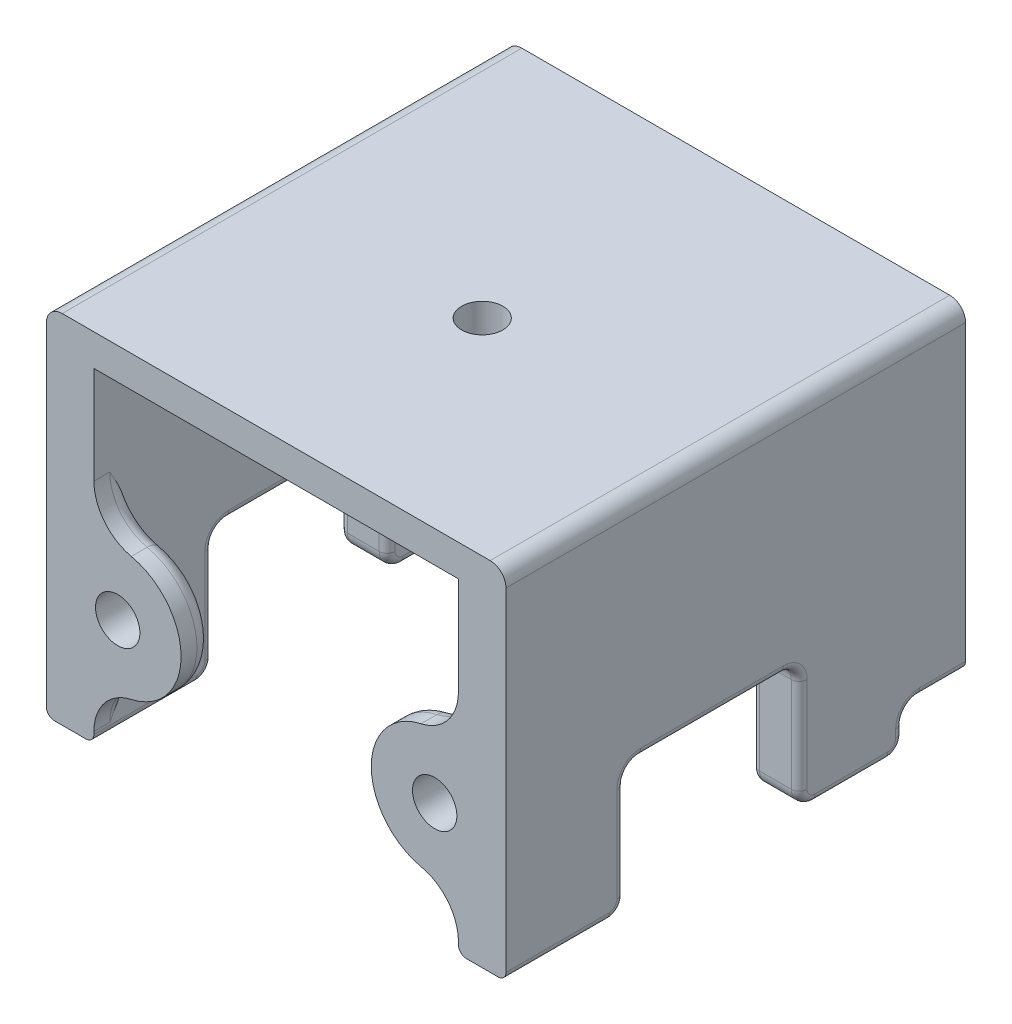
from build123d import *
from OCP.BRepFilletAPI import BRepFilletAPI_MakeChamfer

# Parameters (mm, degrees)
SKIZZE1_W                            = 58
SKIZZE1_H                            = 40
SKIZZE1_R                            = 2.4
SKIZZE1_R_2                          = 1.6
AUFSATZ_LINEAR_AUSTRAGEN1_DEPTH      = 8
AUFSATZ_LINEAR_AUSTRAGEN2_DEPTH      = 50
SCHNITT_LINEAR_AUSTRAGEN6_DEPTH      = 10
SCHNITT_LINEAR_AUSTRAGEN6_DEPTH_BACK = 4
SKIZZE10_R                           = 8
AUFSATZ_LINEAR_AUSTRAGEN3_DEPTH      = 4
SKIZZE13_W                           = 6
SKIZZE13_H                           = 50.174433159
AUFSATZ_LINEAR_AUSTRAGEN4_DEPTH      = 5
VERRUNDUNG1_R                        = 6
VERRUNDUNG3_R                        = 2
SKIZZE11_R                           = 2.8
SCHNITT_LINEAR_AUSTRAGEN7_DEPTH      = 4
SKIZZE7_R                            = 2
SCHNITT_LINEAR_AUSTRAGEN2_DEPTH      = 14
VERRUNDUNG4_R                        = 2
SKIZZE12_W                           = 58
SKIZZE12_H                           = 22
SCHNITT_LINEAR_AUSTRAGEN8_DEPTH      = 16
VERRUNDUNG5_R                        = 2
FASE4_SIZE                           = 4.5
FASE4_SIZE2                          = 1.205771366
LINEARES_MUSTER1_COUNT               = 2
LINEARES_MUSTER1_PITCH               = 52
VERRUNDUNG6_R                        = 1
SKIZZE16_R                           = 16
AUFSATZ_LINEAR_AUSTRAGEN7_DEPTH      = 20
FASE8_SIZE                           = 12
FASE8_SIZE2                          = 6.92820323
SKITZE_AXIS_R                        = 2.6
SCHNITT_LINEAR_AUSTRAGEN10_DEPTH     = 20


# Read off the part's stored shape, not the designer's step: Aufsatz-Linear austragen2
with BuildPart() as part:
    # Skizze1 → Aufsatz-Linear austragen1 (new body)
    with BuildSketch(Plane.XY):
        with Locations((0, -20)):
            Rectangle(SKIZZE1_W, SKIZZE1_H)
        with Locations((-20, -10)):
            Circle(SKIZZE1_R, mode=Mode.SUBTRACT)
        with Locations((0, -10)):
            Circle(SKIZZE1_R, mode=Mode.SUBTRACT)
        with Locations((20, -10)):
            Circle(SKIZZE1_R, mode=Mode.SUBTRACT)
        with Locations((0, -30)):
            Circle(SKIZZE1_R, mode=Mode.SUBTRACT)
        with Locations((20, -30)):
            Circle(SKIZZE1_R, mode=Mode.SUBTRACT)
        with Locations((-20, -30)):
            Circle(SKIZZE1_R, mode=Mode.SUBTRACT)
        with Locations((-10, -20)):
            Circle(SKIZZE1_R_2, mode=Mode.SUBTRACT)
        with Locations((10, -20)):
            Circle(SKIZZE1_R_2, mode=Mode.SUBTRACT)
    extrude(amount=AUFSATZ_LINEAR_AUSTRAGEN1_DEPTH)

    # Aufsatz-Linear austragen2 outline → Aufsatz-Linear austragen2 (add)
    with BuildSketch(Plane.XY.offset(8)):
        Polygon((23, -40), (29, -40), (29, 0), (-29, 0), (-29, -40), (-23, -40), (-23, -4), (23, -4), align=None)
    extrude(amount=AUFSATZ_LINEAR_AUSTRAGEN2_DEPTH)

    # Skizze9 → Schnitt-Linear austragen6 (cut, two sides: drawn at the far end of the back side and taken through both)
    with BuildSketch(Plane.XY.offset(8).offset(-SCHNITT_LINEAR_AUSTRAGEN6_DEPTH_BACK)):
        Polygon((3.5, -7.979274058), (0, -5.958548116), (-3.5, -7.979274058), (-3.5, -12.020725942), (0, -14.041451884), (3.5, -12.020725942), align=None)
        Polygon((-16.5, -7.979274058), (-20, -5.958548116), (-23.5, -7.979274058), (-23.5, -12.020725942), (-20, -14.041451884), (-16.5, -12.020725942), align=None)
        Polygon((23.5, -7.979274058), (20, -5.958548116), (16.5, -7.979274058), (16.5, -12.020725942), (20, -14.041451884), (23.5, -12.020725942), align=None)
        Polygon((3.5, -27.979274058), (0, -25.958548116), (-3.5, -27.979274058), (-3.5, -32.020725942), (0, -34.041451884), (3.5, -32.020725942), align=None)
        Polygon((23.5, -27.979274058), (20, -25.958548116), (16.5, -27.979274058), (16.5, -32.020725942), (20, -34.041451884), (23.5, -32.020725942), align=None)
        Polygon((-16.5, -27.979274058), (-20, -25.958548116), (-23.5, -27.979274058), (-23.5, -32.020725942), (-20, -34.041451884), (-16.5, -32.020725942), align=None)
    extrude(amount=SCHNITT_LINEAR_AUSTRAGEN6_DEPTH + SCHNITT_LINEAR_AUSTRAGEN6_DEPTH_BACK, mode=Mode.SUBTRACT)

    # Skizze10 → Aufsatz-Linear austragen3 (add)
    with BuildSketch(Plane.XY.offset(58)):
        with Locations((20, -30)):
            Circle(SKIZZE10_R)
        with Locations((-20, -30)):
            Circle(SKIZZE10_R)
    extrude(amount=-AUFSATZ_LINEAR_AUSTRAGEN3_DEPTH)

    # Skizze13 → Aufsatz-Linear austragen4 (add)
    with BuildSketch(Plane.XZ.offset(40)):
        with Locations((-26, 32.912783421)):
            Rectangle(SKIZZE13_W, SKIZZE13_H)
        with Locations((26, 32.912783421)):
            Rectangle(SKIZZE13_W, SKIZZE13_H)
    extrude(amount=AUFSATZ_LINEAR_AUSTRAGEN4_DEPTH)

    # Verrundung1
    verrundung1_edges = [part.edges().sort_by_distance(p)[0] for p in [
        (23, -37.416198487, 56),
        (23, -22.583801513, 56),
        (-23, -37.416198487, 56),
        (-23, -22.583801513, 56),
    ]]
    fillet(verrundung1_edges, radius=VERRUNDUNG1_R)

    # Verrundung3
    # the kernel refuses this fillet: 2 mm, written as the material it takes off along each edge
    with BuildSketch(Plane(origin=(-20, -30, 54), x_dir=(0.21428571428571433, -0.9767710236555245, 0), z_dir=(-0.9767710236555245, -0.21428571428571433, 0))) as verrundung3_piece_1:
        with BuildLine():
            CenterArc((8 - VERRUNDUNG3_R, VERRUNDUNG3_R), VERRUNDUNG3_R, 270, 90)
            Line((8 - VERRUNDUNG3_R, 0), (8, 0))
            Line((8, 0), (8, VERRUNDUNG3_R))
        make_face()
    revolve(axis=Axis((-20, -30, 54), (0, 0, 1)), revolution_arc=155.252749768, mode=Mode.SUBTRACT)
    with BuildSketch(Plane(origin=(20, -30, 54), x_dir=(-0.21428571428571433, 0.9767710236555245, 0), z_dir=(0.9767710236555245, 0.21428571428571433, 0))) as verrundung3_piece_2:
        with BuildLine():
            CenterArc((8 - VERRUNDUNG3_R, VERRUNDUNG3_R), VERRUNDUNG3_R, 270, 90)
            Line((8 - VERRUNDUNG3_R, 0), (8, 0))
            Line((8, 0), (8, VERRUNDUNG3_R))
        make_face()
    revolve(axis=Axis((20, -30, 54), (0, 0, 1)), revolution_arc=155.252749768, mode=Mode.SUBTRACT)
    with BuildSketch(Plane(origin=(-17, -16.325205669, 54), x_dir=(-0.6722279054593165, 0.7403442733767718, 0), z_dir=(0.7403442733767718, 0.6722279054593165, 0))) as verrundung3_piece_3_section:
        with BuildLine():
            CenterArc((6 + VERRUNDUNG3_R, VERRUNDUNG3_R), VERRUNDUNG3_R, 180, 90)
            Line((6 + VERRUNDUNG3_R, 0), (6, 0))
            Line((6, 0), (6, VERRUNDUNG3_R))
        make_face()
    verrundung3_piece_3 = revolve(axis=Axis((-17, -16.325205669, 54), (0, 0, 1)), revolution_arc=125.387125524, mode=Mode.PRIVATE)
    verrundung3_piece_3 = split(verrundung3_piece_3, bisect_by=Plane(origin=(-23, -20.355034942, 54.516064296), z_dir=(1, 0, 0)), keep=Keep.TOP, mode=Mode.PRIVATE)
    add(verrundung3_piece_3, mode=Mode.SUBTRACT)
    with BuildSketch(Plane(origin=(-17, -43.674794331, 54), x_dir=(-0.6722279054593165, -0.7403442733767718, 0), z_dir=(0.7403442733767718, -0.6722279054593165, 0))) as verrundung3_piece_4_section:
        with BuildLine():
            CenterArc((6 + VERRUNDUNG3_R, -VERRUNDUNG3_R), VERRUNDUNG3_R, 90, 90)
            Line((6, -VERRUNDUNG3_R), (6, 0))
            Line((6, 0), (6 + VERRUNDUNG3_R, 0))
        make_face()
    verrundung3_piece_4 = revolve(axis=Axis((-17, -43.674794331, 54), (0, 0, -1)), revolution_arc=125.387125524, mode=Mode.PRIVATE)
    verrundung3_piece_4 = split(verrundung3_piece_4, bisect_by=Plane(origin=(-23, -39.644965239, 54.51606418), z_dir=(1, 0, 0)), keep=Keep.TOP, mode=Mode.PRIVATE)
    add(verrundung3_piece_4, mode=Mode.SUBTRACT)
    with BuildSketch(Plane(origin=(17, -43.674794331, 54), x_dir=(0.6722279054593165, -0.7403442733767718, 0), z_dir=(-0.7403442733767718, -0.6722279054593165, 0))) as verrundung3_piece_5_section:
        with BuildLine():
            CenterArc((6 + VERRUNDUNG3_R, VERRUNDUNG3_R), VERRUNDUNG3_R, 180, 90)
            Line((6 + VERRUNDUNG3_R, 0), (6, 0))
            Line((6, 0), (6, VERRUNDUNG3_R))
        make_face()
    verrundung3_piece_5 = revolve(axis=Axis((17, -43.674794331, 54), (0, 0, 1)), revolution_arc=125.387125524, mode=Mode.PRIVATE)
    verrundung3_piece_5 = split(verrundung3_piece_5, bisect_by=Plane(origin=(23, -39.644963205, 54.516060737), z_dir=(-1, 0, 0)), keep=Keep.TOP, mode=Mode.PRIVATE)
    add(verrundung3_piece_5, mode=Mode.SUBTRACT)
    with BuildSketch(Plane(origin=(17, -16.325205669, 54), x_dir=(0.672227905459316, 0.7403442733767723, 0), z_dir=(-0.7403442733767723, 0.672227905459316, 0))) as verrundung3_piece_6_section:
        with BuildLine():
            CenterArc((6 + VERRUNDUNG3_R, -VERRUNDUNG3_R), VERRUNDUNG3_R, 90, 90)
            Line((6, -VERRUNDUNG3_R), (6, 0))
            Line((6, 0), (6 + VERRUNDUNG3_R, 0))
        make_face()
    verrundung3_piece_6 = revolve(axis=Axis((17, -16.325205669, 54), (0, 0, -1)), revolution_arc=125.387125524, mode=Mode.PRIVATE)
    verrundung3_piece_6 = split(verrundung3_piece_6, bisect_by=Plane(origin=(23, -20.355037546, 54.516064213), z_dir=(-1, 0, 0)), keep=Keep.TOP, mode=Mode.PRIVATE)
    add(verrundung3_piece_6, mode=Mode.SUBTRACT)

    # Skizze11 → Schnitt-Linear austragen7 (cut)
    with BuildSketch(Plane.XY.offset(58)):
        with Locations((20, -30)):
            Circle(SKIZZE11_R)
        with Locations((-20, -30)):
            Circle(SKIZZE11_R)
    extrude(amount=-SCHNITT_LINEAR_AUSTRAGEN7_DEPTH, mode=Mode.SUBTRACT)

    # Skizze7 → Schnitt-Linear austragen2 (cut)
    with BuildSketch(Plane.XZ.offset(45)):
        with Locations(Location((26, 15.300827002, 0), (0, 0, 270))):
            Circle(SKIZZE7_R)
        with Locations(Location((26, 50.800827002, 0), (0, 0, 270))):
            Circle(SKIZZE7_R)
    schnitt_linear_austragen2 = extrude(amount=-SCHNITT_LINEAR_AUSTRAGEN2_DEPTH, mode=Mode.SUBTRACT)

    # Verrundung4
    verrundung4_edges = [part.edges().sort_by_distance(p)[0] for p in [
        (-29, 0, 29),
        (29, 0, 29),
    ]]
    fillet(verrundung4_edges, radius=VERRUNDUNG4_R)

    # Skizze12 → Schnitt-Linear austragen8 (cut)
    with BuildSketch(Plane.XZ.offset(45)):
        with Locations((0, 32)):
            Rectangle(SKIZZE12_W, SKIZZE12_H)
    extrude(amount=-SCHNITT_LINEAR_AUSTRAGEN8_DEPTH, mode=Mode.SUBTRACT)

    # Verrundung5
    verrundung5_edges = [part.edges().sort_by_distance(p)[0] for p in [
        (-26, -40, 7.825566841),
        (-26, -45, 7.825566841),
        (26, -40, 7.825566841),
        (26, -45, 7.825566841),
        (26, -45, 21),
        (-26, -45, 21),
        (-26, -45, 43),
        (-26, -29, 43),
        (-26, -29, 21),
        (26, -29, 43),
        (26, -29, 21),
        (26, -45, 43),
    ]]
    fillet(verrundung5_edges, radius=VERRUNDUNG5_R)

    # Fase4: one chamfer whose edges measure the first distance from different faces: ONE call of the kernel's chamfer builder (chamfer() names one face for all edges)
    fase4_edges_1 = [part.edges().sort_by_distance(p)[0] for p in [
        (-11.6, -20, 0),
    ]]
    fase4_side_1 = [part.faces().sort_by_distance(p)[0] for p in [
        (-11.6, -20, 4),
    ]]
    fase4_edges_2 = [part.edges().sort_by_distance(p)[0] for p in [
        (8.4, -20, 0),
    ]]
    fase4_side_2 = [part.faces().sort_by_distance(p)[0] for p in [
        (8.4, -20, 4),
    ]]
    fase4 = BRepFilletAPI_MakeChamfer(part.part.solid().wrapped)
    for e in fase4_edges_1:
        fase4.Add(FASE4_SIZE, FASE4_SIZE2, e.wrapped, fase4_side_1[0].wrapped)  # the first distance lies on this face
    for e in fase4_edges_2:
        fase4.Add(FASE4_SIZE, FASE4_SIZE2, e.wrapped, fase4_side_2[0].wrapped)  # the first distance lies on this face
    add(Compound.cast(fase4.Shape()), mode=Mode.REPLACE)

    # Lineares Muster1: Schnitt-Linear austragen2 ×2
    with Locations(*[(-i * LINEARES_MUSTER1_PITCH, 0, 0) for i in range(1, LINEARES_MUSTER1_COUNT)]):
        add(schnitt_linear_austragen2, mode=Mode.SUBTRACT)

    # Verrundung6
    # the kernel refuses this fillet: 1 mm, written as the material it takes off along each edge
    with BuildSketch(Plane(origin=(-23, -42, 5.825566841), x_dir=(0, 0.3148458040869784, -0.9491428341660828), z_dir=(0, -0.9491428341660828, -0.3148458040869784))) as verrundung6_piece_1_section:
        with BuildLine():
            CenterArc((2 + VERRUNDUNG6_R, -VERRUNDUNG6_R), VERRUNDUNG6_R, 90, 90)
            Line((2, -VERRUNDUNG6_R), (2, 0))
            Line((2, 0), (2 + VERRUNDUNG6_R, 0))
        make_face()
    verrundung6_piece_1 = revolve(axis=Axis((-23, -42, 5.825566841), (1, 0, 0)), revolution_arc=161.648494619, mode=Mode.PRIVATE)
    verrundung6_piece_1 = split(verrundung6_piece_1, bisect_by=Plane(origin=(-23.272151062, -40, 7.287763131), z_dir=(0, -1, 0)), keep=Keep.TOP, mode=Mode.PRIVATE)
    add(verrundung6_piece_1, mode=Mode.SUBTRACT)
    with BuildSketch(Plane(origin=(-23, -42, 5.825566841), x_dir=(0, 0.3148458040869784, -0.9491428341660828), z_dir=(0, -0.9491428341660828, -0.3148458040869784))) as verrundung6_piece_2_section:
        with BuildLine():
            CenterArc((2 + VERRUNDUNG6_R, -VERRUNDUNG6_R), VERRUNDUNG6_R, 90, 90)
            Line((2, -VERRUNDUNG6_R), (2, 0))
            Line((2, 0), (2 + VERRUNDUNG6_R, 0))
        make_face()
    verrundung6_piece_2 = revolve(axis=Axis((-23, -42, 5.825566841), (1, 0, 0)), revolution_arc=161.648494619, mode=Mode.PRIVATE)
    verrundung6_piece_2 = split(verrundung6_piece_2, bisect_by=Plane(origin=(-23.00020869, -39.986552232, 8), z_dir=(0, 0, 1)), keep=Keep.TOP, mode=Mode.PRIVATE)
    add(verrundung6_piece_2, mode=Mode.SUBTRACT)
    with BuildSketch(Plane(origin=(-23, -42, 7.825566841), x_dir=(0, 0, 1), z_dir=(0, -1, 0)), Plane(origin=(29, -42, 7.825566841), x_dir=(0, 0, 1), z_dir=(0, -1, 0))) as verrundung6_piece_3:
        with BuildLine():
            CenterArc((VERRUNDUNG6_R, VERRUNDUNG6_R), VERRUNDUNG6_R, 180, 90)
            Line((0, VERRUNDUNG6_R), (0, 0))
            Line((0, 0), (VERRUNDUNG6_R, 0))
        make_face()
    extrude(amount=1, mode=Mode.SUBTRACT)
    with BuildSketch(Plane(origin=(-23, -43, 9.825566841), x_dir=(0, -1, 0), z_dir=(0, 0, 1))) as verrundung6_piece_4:
        with BuildLine():
            CenterArc((2 - VERRUNDUNG6_R, -VERRUNDUNG6_R), VERRUNDUNG6_R, 0, 90)
            Line((2, -VERRUNDUNG6_R), (2, 0))
            Line((2, 0), (2 - VERRUNDUNG6_R, 0))
        make_face()
    revolve(axis=Axis((-23, -43, 9.825566841), (1, 0, 0)), revolution_arc=90, mode=Mode.SUBTRACT)
    with BuildSketch(Plane(origin=(-23, -45, 19), x_dir=(0, 1, 0), z_dir=(0, 0, -1)), Plane(origin=(-29, -45, 9.825566841), x_dir=(0, 1, 0), z_dir=(0, 0, 1)), Plane(origin=(23, -45, 9.825566841), x_dir=(0, 1, 0), z_dir=(0, 0, 1)), Plane(origin=(29, -45, 19), x_dir=(0, 1, 0), z_dir=(0, 0, -1))) as verrundung6_piece_5:
        with BuildLine():
            CenterArc((VERRUNDUNG6_R, -VERRUNDUNG6_R), VERRUNDUNG6_R, 90, 90)
            Line((0, -VERRUNDUNG6_R), (0, 0))
            Line((0, 0), (VERRUNDUNG6_R, 0))
        make_face()
    extrude(amount=9.174433159, mode=Mode.SUBTRACT)
    with BuildSketch(Plane(origin=(-23, -43, 19), x_dir=(0, 0, 1), z_dir=(0, 1, 0))) as verrundung6_piece_6:
        with BuildLine():
            CenterArc((2 - VERRUNDUNG6_R, -VERRUNDUNG6_R), VERRUNDUNG6_R, 0, 90)
            Line((2, -VERRUNDUNG6_R), (2, 0))
            Line((2, 0), (2 - VERRUNDUNG6_R, 0))
        make_face()
    revolve(axis=Axis((-23, -43, 19), (1, 0, 0)), revolution_arc=90, mode=Mode.SUBTRACT)
    with BuildSketch(Plane(origin=(-23, -43, 21), x_dir=(0, 0, -1), z_dir=(0, 1, 0)), Plane(origin=(-23, -31, 43), x_dir=(0, 0, 1), z_dir=(0, -1, 0)), Plane(origin=(-29, -43, 43), x_dir=(0, 0, 1), z_dir=(0, 1, 0)), Plane(origin=(23, -31, 21), x_dir=(0, 0, -1), z_dir=(0, -1, 0)), Plane(origin=(23, -43, 43), x_dir=(0, 0, 1), z_dir=(0, 1, 0)), Plane(origin=(29, -43, 21), x_dir=(0, 0, -1), z_dir=(0, 1, 0))) as verrundung6_piece_7:
        with BuildLine():
            CenterArc((VERRUNDUNG6_R, VERRUNDUNG6_R), VERRUNDUNG6_R, 180, 90)
            Line((0, VERRUNDUNG6_R), (0, 0))
            Line((0, 0), (VERRUNDUNG6_R, 0))
        make_face()
    extrude(amount=12, mode=Mode.SUBTRACT)
    with BuildSketch(Plane(origin=(-23, -31, 23), x_dir=(0, 1, 0), z_dir=(0, 0, 1))) as verrundung6_piece_8:
        with BuildLine():
            CenterArc((2 + VERRUNDUNG6_R, VERRUNDUNG6_R), VERRUNDUNG6_R, 180, 90)
            Line((2, VERRUNDUNG6_R), (2, 0))
            Line((2, 0), (2 + VERRUNDUNG6_R, 0))
        make_face()
    revolve(axis=Axis((-23, -31, 23), (-1, 0, 0)), revolution_arc=90, mode=Mode.SUBTRACT)
    with BuildSketch(Plane(origin=(-23, -29, 41), x_dir=(0, 1, 0), z_dir=(0, 0, -1)), Plane(origin=(-29, -29, 23), x_dir=(0, 1, 0), z_dir=(0, 0, 1)), Plane(origin=(23, -29, 23), x_dir=(0, 1, 0), z_dir=(0, 0, 1)), Plane(origin=(29, -29, 41), x_dir=(0, 1, 0), z_dir=(0, 0, -1))) as verrundung6_piece_9:
        with BuildLine():
            CenterArc((VERRUNDUNG6_R, -VERRUNDUNG6_R), VERRUNDUNG6_R, 90, 90)
            Line((0, -VERRUNDUNG6_R), (0, 0))
            Line((0, 0), (VERRUNDUNG6_R, 0))
        make_face()
    extrude(amount=18, mode=Mode.SUBTRACT)
    with BuildSketch(Plane(origin=(-23, -31, 41), x_dir=(0, 0, 1), z_dir=(0, -1, 0))) as verrundung6_piece_10:
        with BuildLine():
            CenterArc((2 + VERRUNDUNG6_R, VERRUNDUNG6_R), VERRUNDUNG6_R, 180, 90)
            Line((2, VERRUNDUNG6_R), (2, 0))
            Line((2, 0), (2 + VERRUNDUNG6_R, 0))
        make_face()
    revolve(axis=Axis((-23, -31, 41), (-1, 0, 0)), revolution_arc=90, mode=Mode.SUBTRACT)
    with BuildSketch(Plane(origin=(-23, -43, 45), x_dir=(0, -1, 0), z_dir=(0, 0, 1))) as verrundung6_piece_11:
        with BuildLine():
            CenterArc((2 - VERRUNDUNG6_R, -VERRUNDUNG6_R), VERRUNDUNG6_R, 0, 90)
            Line((2, -VERRUNDUNG6_R), (2, 0))
            Line((2, 0), (2 - VERRUNDUNG6_R, 0))
        make_face()
    revolve(axis=Axis((-23, -43, 45), (1, 0, 0)), revolution_arc=90, mode=Mode.SUBTRACT)
    with BuildSketch(Plane(origin=(-29, -40, -2.5), x_dir=(1, 0, 0), z_dir=(0, 0, 1)), Plane(origin=(29, -40, 5.825566841), x_dir=(-1, 0, 0), z_dir=(0, 0, -1))) as verrundung6_piece_12:
        with BuildLine():
            CenterArc((VERRUNDUNG6_R, VERRUNDUNG6_R), VERRUNDUNG6_R, 180, 90)
            Line((0, VERRUNDUNG6_R), (0, 0))
            Line((0, 0), (VERRUNDUNG6_R, 0))
        make_face()
    extrude(amount=8.325566841, mode=Mode.SUBTRACT)
    with BuildSketch(Plane(origin=(-29, -42, 5.825566841), x_dir=(0, 1, 0), z_dir=(0, 0, -1))) as verrundung6_piece_13:
        with BuildLine():
            CenterArc((2 + VERRUNDUNG6_R, VERRUNDUNG6_R), VERRUNDUNG6_R, 180, 90)
            Line((2, VERRUNDUNG6_R), (2, 0))
            Line((2, 0), (2 + VERRUNDUNG6_R, 0))
        make_face()
    revolve(axis=Axis((-29, -42, 5.825566841), (1, 0, 0)), revolution_arc=90, mode=Mode.SUBTRACT)
    with BuildSketch(Plane(origin=(-29, -42, 7.825566841), x_dir=(0, 0, 1), z_dir=(0, -1, 0)), Plane(origin=(23, -42, 7.825566841), x_dir=(0, 0, 1), z_dir=(0, -1, 0))) as verrundung6_piece_14:
        with BuildLine():
            CenterArc((VERRUNDUNG6_R, -VERRUNDUNG6_R), VERRUNDUNG6_R, 90, 90)
            Line((0, -VERRUNDUNG6_R), (0, 0))
            Line((0, 0), (VERRUNDUNG6_R, 0))
        make_face()
    extrude(amount=1, mode=Mode.SUBTRACT)
    with BuildSketch(Plane(origin=(-29, -43, 9.825566841), x_dir=(0, -1, 0), z_dir=(0, 0, 1))) as verrundung6_piece_15:
        with BuildLine():
            CenterArc((2 - VERRUNDUNG6_R, VERRUNDUNG6_R), VERRUNDUNG6_R, 270, 90)
            Line((2, VERRUNDUNG6_R), (2, 0))
            Line((2, 0), (2 - VERRUNDUNG6_R, 0))
        make_face()
    revolve(axis=Axis((-29, -43, 9.825566841), (1, 0, 0)), revolution_arc=90, mode=Mode.SUBTRACT)
    with BuildSketch(Plane(origin=(-29, -43, 19), x_dir=(0, 0, 1), z_dir=(0, 1, 0))) as verrundung6_piece_16:
        with BuildLine():
            CenterArc((2 - VERRUNDUNG6_R, VERRUNDUNG6_R), VERRUNDUNG6_R, 270, 90)
            Line((2, VERRUNDUNG6_R), (2, 0))
            Line((2, 0), (2 - VERRUNDUNG6_R, 0))
        make_face()
    revolve(axis=Axis((-29, -43, 19), (1, 0, 0)), revolution_arc=90, mode=Mode.SUBTRACT)
    with BuildSketch(Plane(origin=(-29, -43, 21), x_dir=(0, 0, -1), z_dir=(0, 1, 0)), Plane(origin=(29, -43, 43), x_dir=(0, 0, 1), z_dir=(0, 1, 0))) as verrundung6_piece_17:
        with BuildLine():
            CenterArc((VERRUNDUNG6_R, -VERRUNDUNG6_R), VERRUNDUNG6_R, 90, 90)
            Line((0, -VERRUNDUNG6_R), (0, 0))
            Line((0, 0), (VERRUNDUNG6_R, 0))
        make_face()
    extrude(amount=12, mode=Mode.SUBTRACT)
    with BuildSketch(Plane(origin=(-29, -31, 23), x_dir=(0, 1, 0), z_dir=(0, 0, 1))) as verrundung6_piece_18:
        with BuildLine():
            CenterArc((2 + VERRUNDUNG6_R, -VERRUNDUNG6_R), VERRUNDUNG6_R, 90, 90)
            Line((2, -VERRUNDUNG6_R), (2, 0))
            Line((2, 0), (2 + VERRUNDUNG6_R, 0))
        make_face()
    revolve(axis=Axis((-29, -31, 23), (-1, 0, 0)), revolution_arc=90, mode=Mode.SUBTRACT)
    with BuildSketch(Plane(origin=(-29, -31, 41), x_dir=(0, 0, 1), z_dir=(0, -1, 0))) as verrundung6_piece_19:
        with BuildLine():
            CenterArc((2 + VERRUNDUNG6_R, -VERRUNDUNG6_R), VERRUNDUNG6_R, 90, 90)
            Line((2, -VERRUNDUNG6_R), (2, 0))
            Line((2, 0), (2 + VERRUNDUNG6_R, 0))
        make_face()
    revolve(axis=Axis((-29, -31, 41), (-1, 0, 0)), revolution_arc=90, mode=Mode.SUBTRACT)
    with BuildSketch(Plane(origin=(-29, -43, 45), x_dir=(0, -1, 0), z_dir=(0, 0, 1))) as verrundung6_piece_20:
        with BuildLine():
            CenterArc((2 - VERRUNDUNG6_R, VERRUNDUNG6_R), VERRUNDUNG6_R, 270, 90)
            Line((2, VERRUNDUNG6_R), (2, 0))
            Line((2, 0), (2 - VERRUNDUNG6_R, 0))
        make_face()
    revolve(axis=Axis((-29, -43, 45), (1, 0, 0)), revolution_arc=90, mode=Mode.SUBTRACT)
    with BuildSketch(Plane(origin=(-23, -45, 60.5), x_dir=(0, 1, 0), z_dir=(0, 0, -1)), Plane(origin=(-29, -45, 45), x_dir=(0, 1, 0), z_dir=(0, 0, 1)), Plane(origin=(23, -45, 45), x_dir=(0, 1, 0), z_dir=(0, 0, 1)), Plane(origin=(29, -45, 60.5), x_dir=(0, 1, 0), z_dir=(0, 0, -1))) as verrundung6_piece_21:
        with BuildLine():
            CenterArc((VERRUNDUNG6_R, -VERRUNDUNG6_R), VERRUNDUNG6_R, 90, 90)
            Line((0, -VERRUNDUNG6_R), (0, 0))
            Line((0, 0), (VERRUNDUNG6_R, 0))
        make_face()
    extrude(amount=15.5, mode=Mode.SUBTRACT)
    with BuildSketch(Plane(origin=(23, -42, 5.825566841), x_dir=(0, 0.3148458040869784, -0.9491428341660828), z_dir=(0, -0.9491428341660828, -0.3148458040869784))) as verrundung6_piece_22_section:
        with BuildLine():
            CenterArc((2 + VERRUNDUNG6_R, VERRUNDUNG6_R), VERRUNDUNG6_R, 180, 90)
            Line((2, VERRUNDUNG6_R), (2, 0))
            Line((2, 0), (2 + VERRUNDUNG6_R, 0))
        make_face()
    verrundung6_piece_22 = revolve(axis=Axis((23, -42, 5.825566841), (1, 0, 0)), revolution_arc=161.648494619, mode=Mode.PRIVATE)
    verrundung6_piece_22 = split(verrundung6_piece_22, bisect_by=Plane(origin=(23.272151116, -40, 7.287763135), z_dir=(0, -1, 0)), keep=Keep.TOP, mode=Mode.PRIVATE)
    add(verrundung6_piece_22, mode=Mode.SUBTRACT)
    with BuildSketch(Plane(origin=(23, -42, 5.825566841), x_dir=(0, 0.3148458040869784, -0.9491428341660828), z_dir=(0, -0.9491428341660828, -0.3148458040869784))) as verrundung6_piece_23_section:
        with BuildLine():
            CenterArc((2 + VERRUNDUNG6_R, VERRUNDUNG6_R), VERRUNDUNG6_R, 180, 90)
            Line((2, VERRUNDUNG6_R), (2, 0))
            Line((2, 0), (2 + VERRUNDUNG6_R, 0))
        make_face()
    verrundung6_piece_23 = revolve(axis=Axis((23, -42, 5.825566841), (1, 0, 0)), revolution_arc=161.648494619, mode=Mode.PRIVATE)
    verrundung6_piece_23 = split(verrundung6_piece_23, bisect_by=Plane(origin=(23.00020869, -39.986552232, 8), z_dir=(0, 0, 1)), keep=Keep.TOP, mode=Mode.PRIVATE)
    add(verrundung6_piece_23, mode=Mode.SUBTRACT)
    with BuildSketch(Plane(origin=(23, -43, 9.825566841), x_dir=(0, 0, -1), z_dir=(0, 1, 0))) as verrundung6_piece_24:
        with BuildLine():
            CenterArc((2 - VERRUNDUNG6_R, -VERRUNDUNG6_R), VERRUNDUNG6_R, 0, 90)
            Line((2, -VERRUNDUNG6_R), (2, 0))
            Line((2, 0), (2 - VERRUNDUNG6_R, 0))
        make_face()
    revolve(axis=Axis((23, -43, 9.825566841), (-1, 0, 0)), revolution_arc=90, mode=Mode.SUBTRACT)
    with BuildSketch(Plane(origin=(23, -43, 19), x_dir=(0, -1, 0), z_dir=(0, 0, -1))) as verrundung6_piece_25:
        with BuildLine():
            CenterArc((2 - VERRUNDUNG6_R, -VERRUNDUNG6_R), VERRUNDUNG6_R, 0, 90)
            Line((2, -VERRUNDUNG6_R), (2, 0))
            Line((2, 0), (2 - VERRUNDUNG6_R, 0))
        make_face()
    revolve(axis=Axis((23, -43, 19), (-1, 0, 0)), revolution_arc=90, mode=Mode.SUBTRACT)
    with BuildSketch(Plane(origin=(23, -31, 23), x_dir=(0, 0, -1), z_dir=(0, -1, 0))) as verrundung6_piece_26:
        with BuildLine():
            CenterArc((2 + VERRUNDUNG6_R, VERRUNDUNG6_R), VERRUNDUNG6_R, 180, 90)
            Line((2, VERRUNDUNG6_R), (2, 0))
            Line((2, 0), (2 + VERRUNDUNG6_R, 0))
        make_face()
    revolve(axis=Axis((23, -31, 23), (1, 0, 0)), revolution_arc=90, mode=Mode.SUBTRACT)
    with BuildSketch(Plane(origin=(23, -31, 41), x_dir=(0, 1, 0), z_dir=(0, 0, -1))) as verrundung6_piece_27:
        with BuildLine():
            CenterArc((2 + VERRUNDUNG6_R, VERRUNDUNG6_R), VERRUNDUNG6_R, 180, 90)
            Line((2, VERRUNDUNG6_R), (2, 0))
            Line((2, 0), (2 + VERRUNDUNG6_R, 0))
        make_face()
    revolve(axis=Axis((23, -31, 41), (1, 0, 0)), revolution_arc=90, mode=Mode.SUBTRACT)
    with BuildSketch(Plane(origin=(23, -43, 45), x_dir=(0, -1, 0), z_dir=(0, 0, 1))) as verrundung6_piece_28:
        with BuildLine():
            CenterArc((2 - VERRUNDUNG6_R, VERRUNDUNG6_R), VERRUNDUNG6_R, 270, 90)
            Line((2, VERRUNDUNG6_R), (2, 0))
            Line((2, 0), (2 - VERRUNDUNG6_R, 0))
        make_face()
    revolve(axis=Axis((23, -43, 45), (1, 0, 0)), revolution_arc=90, mode=Mode.SUBTRACT)
    with BuildSketch(Plane(origin=(29, -42, 5.825566841), x_dir=(0, 1, 0), z_dir=(0, 0, -1))) as verrundung6_piece_29:
        with BuildLine():
            CenterArc((2 + VERRUNDUNG6_R, -VERRUNDUNG6_R), VERRUNDUNG6_R, 90, 90)
            Line((2, -VERRUNDUNG6_R), (2, 0))
            Line((2, 0), (2 + VERRUNDUNG6_R, 0))
        make_face()
    revolve(axis=Axis((29, -42, 5.825566841), (1, 0, 0)), revolution_arc=90, mode=Mode.SUBTRACT)
    with BuildSketch(Plane(origin=(29, -43, 9.825566841), x_dir=(0, 0, -1), z_dir=(0, 1, 0))) as verrundung6_piece_30:
        with BuildLine():
            CenterArc((2 - VERRUNDUNG6_R, VERRUNDUNG6_R), VERRUNDUNG6_R, 270, 90)
            Line((2, VERRUNDUNG6_R), (2, 0))
            Line((2, 0), (2 - VERRUNDUNG6_R, 0))
        make_face()
    revolve(axis=Axis((29, -43, 9.825566841), (-1, 0, 0)), revolution_arc=90, mode=Mode.SUBTRACT)
    with BuildSketch(Plane(origin=(29, -43, 19), x_dir=(0, -1, 0), z_dir=(0, 0, -1))) as verrundung6_piece_31:
        with BuildLine():
            CenterArc((2 - VERRUNDUNG6_R, VERRUNDUNG6_R), VERRUNDUNG6_R, 270, 90)
            Line((2, VERRUNDUNG6_R), (2, 0))
            Line((2, 0), (2 - VERRUNDUNG6_R, 0))
        make_face()
    revolve(axis=Axis((29, -43, 19), (-1, 0, 0)), revolution_arc=90, mode=Mode.SUBTRACT)
    with BuildSketch(Plane(origin=(29, -31, 23), x_dir=(0, 0, -1), z_dir=(0, -1, 0))) as verrundung6_piece_32:
        with BuildLine():
            CenterArc((2 + VERRUNDUNG6_R, -VERRUNDUNG6_R), VERRUNDUNG6_R, 90, 90)
            Line((2, -VERRUNDUNG6_R), (2, 0))
            Line((2, 0), (2 + VERRUNDUNG6_R, 0))
        make_face()
    revolve(axis=Axis((29, -31, 23), (1, 0, 0)), revolution_arc=90, mode=Mode.SUBTRACT)
    with BuildSketch(Plane(origin=(29, -31, 41), x_dir=(0, 1, 0), z_dir=(0, 0, -1))) as verrundung6_piece_33:
        with BuildLine():
            CenterArc((2 + VERRUNDUNG6_R, -VERRUNDUNG6_R), VERRUNDUNG6_R, 90, 90)
            Line((2, -VERRUNDUNG6_R), (2, 0))
            Line((2, 0), (2 + VERRUNDUNG6_R, 0))
        make_face()
    revolve(axis=Axis((29, -31, 41), (1, 0, 0)), revolution_arc=90, mode=Mode.SUBTRACT)
    with BuildSketch(Plane(origin=(29, -43, 45), x_dir=(0, -1, 0), z_dir=(0, 0, 1))) as verrundung6_piece_34:
        with BuildLine():
            CenterArc((2 - VERRUNDUNG6_R, -VERRUNDUNG6_R), VERRUNDUNG6_R, 0, 90)
            Line((2, -VERRUNDUNG6_R), (2, 0))
            Line((2, 0), (2 - VERRUNDUNG6_R, 0))
        make_face()
    revolve(axis=Axis((29, -43, 45), (1, 0, 0)), revolution_arc=90, mode=Mode.SUBTRACT)

    # Skizze16 → Aufsatz-Linear austragen7 (add)
    with BuildSketch(Plane(origin=(0, 0, 0), x_dir=(1, 0, 0), z_dir=(0, 1, 0))):
        with Locations(Location((0, -32, 0), (0, 0, 270))):
            Circle(SKIZZE16_R)
    extrude(amount=-AUFSATZ_LINEAR_AUSTRAGEN7_DEPTH)

    # Fase8
    fase8_edges = [part.edges().sort_by_distance(p)[0] for p in [
        (0, -20, 16),
    ]]
    fase8_side = [part.faces().sort_by_distance(p)[0] for p in [
        (0, -12, 16),
    ]]
    chamfer(fase8_edges, length=FASE8_SIZE, length2=FASE8_SIZE2, reference=fase8_side[0])

    # Skitze Axis → Schnitt-Linear austragen10 (cut)
    with BuildSketch(Plane(origin=(0, 0, 0), x_dir=(1, 0, 0), z_dir=(0, 1, 0))):
        with Locations(Location((0, -32, 0), (0, 0, 270))):
            Circle(SKITZE_AXIS_R)
    extrude(amount=-SCHNITT_LINEAR_AUSTRAGEN10_DEPTH, mode=Mode.SUBTRACT)


solid = part.part
